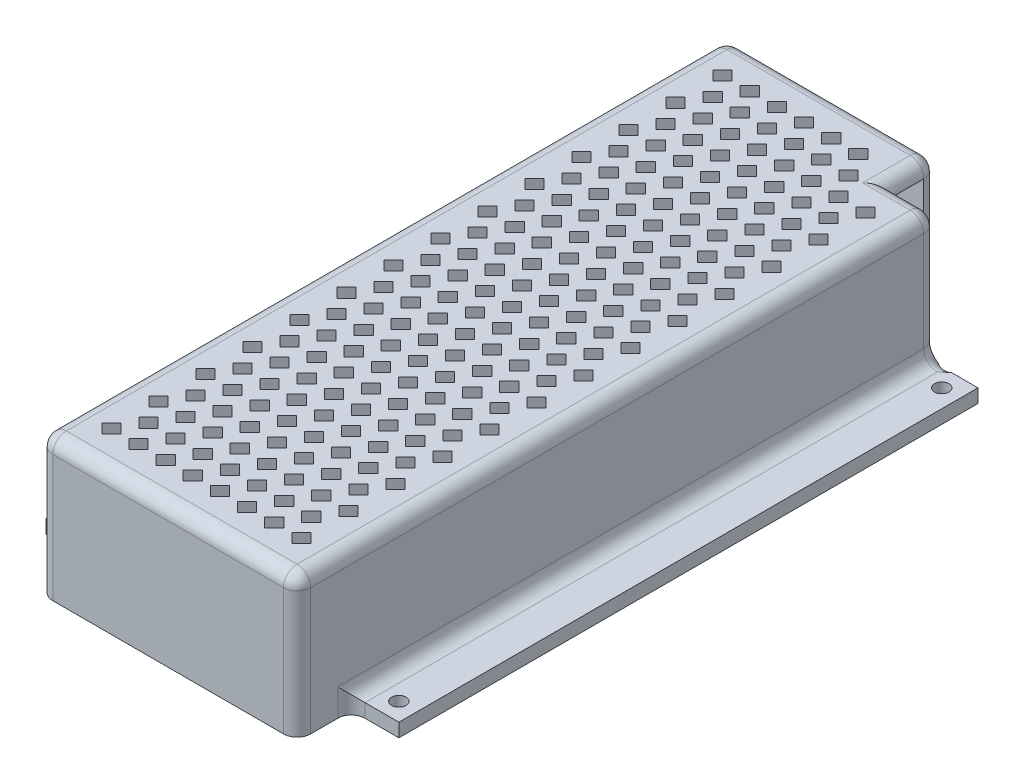
from build123d import *

# Parameters (mm, degrees)
BOSS_EXTRUDE1_DEPTH      = 73
BOSS_EXTRUDE1_DEPTH_BACK = 73
SKETCH1_W                = 51
SKETCH1_H                = 28
SHELL1_T                 = 3
SKETCH2_W                = 10.5
SKETCH2_H                = 8
SKETCH2_R                = 1.6
SKETCH2_H_2              = 112
BOSS_EXTRUDE2_DEPTH      = 3
FILLET1_R                = 3
FILLET2_R                = 3
SKETCH3_W                = 22.686699439
SKETCH3_H                = 21.76198431
CUT_EXTRUDE1_DEPTH       = 56
FILLET3_R                = 3
FILL_START               = 14
FILL_PATTERN1_DEPTH      = 3


# Read off the part's stored shape, not the designer's step: Fill Pattern1
with BuildPart() as part:
    # Sketch1 → Boss-Extrude1 (new, two sides: drawn at the far end of the back side and taken through both)
    with BuildSketch(Plane.XY.offset(-BOSS_EXTRUDE1_DEPTH_BACK)):
        Rectangle(SKETCH1_W, SKETCH1_H)
    extrude(amount=BOSS_EXTRUDE1_DEPTH + BOSS_EXTRUDE1_DEPTH_BACK)

    # Shell1
    shell1_openings = [part.faces().sort_by_distance(p)[0] for p in [
        (0, -14, 0),
    ]]
    offset(amount=SHELL1_T, openings=shell1_openings, kind=Kind.INTERSECTION)

    # Sketch2 → Boss-Extrude2 (add)
    # profile 1 of 6: a face of its own
    with BuildSketch(Plane.XZ.offset(14)):
        with Locations((-33.75, 60)):
            Rectangle(SKETCH2_W, SKETCH2_H)
        with Locations(Location((-35, 60, 0), (0, 0, 270))):
            Circle(SKETCH2_R, mode=Mode.SUBTRACT)
    # profile 2 of 6: a face of its own
    with BuildSketch(Plane.XZ.offset(14)):
        with Locations((33.75, 60)):
            Rectangle(SKETCH2_W, SKETCH2_H)
        with Locations(Location((35, 60, 0), (0, 0, 270))):
            Circle(SKETCH2_R, mode=Mode.SUBTRACT)
    # profile 3 of 6: a face of its own
    with BuildSketch(Plane.XZ.offset(14)):
        with Locations((33.75, -60)):
            Rectangle(SKETCH2_W, SKETCH2_H)
        with Locations(Location((35, -60, 0), (0, 0, 270))):
            Circle(SKETCH2_R, mode=Mode.SUBTRACT)
    # profile 4 of 6: a face of its own
    with BuildSketch(Plane.XZ.offset(14)):
        with Locations((-33.75, -60)):
            Rectangle(SKETCH2_W, SKETCH2_H)
        with Locations(Location((-35, -60, 0), (0, 0, 270))):
            Circle(SKETCH2_R, mode=Mode.SUBTRACT)
    # profile 5 of 6: a face of its own
    with BuildSketch(Plane.XZ.offset(14)):
        with Locations((-33.75, 0)):
            Rectangle(SKETCH2_W, SKETCH2_H_2)
    # profile 6 of 6: a face of its own
    with BuildSketch(Plane.XZ.offset(14)):
        with Locations((33.75, 0)):
            Rectangle(SKETCH2_W, SKETCH2_H_2)
    extrude(amount=-BOSS_EXTRUDE2_DEPTH)

    # Fillet1
    fillet1_edges = [part.edges().sort_by_distance(p)[0] for p in [
        (-28.5, -12.5, 64),
        (-28.5, -12.5, -64),
        (-28.5, -11, 0),
        (28.5, -12.5, 64),
        (28.5, -12.5, -64),
        (28.5, -11, 0),
    ]]
    fillet(fillet1_edges, radius=FILLET1_R)

    # Fillet2
    fillet2_edges = [part.edges().sort_by_distance(p)[0] for p in [
        (28.5, 1.5, 76),
        (-28.5, 1.5, -76),
        (0, 17, 76),
        (-28.5, 1.5, 76),
        (28.5, 1.5, -76),
        (-28.5, 17, 0),
        (28.5, 17, 0),
        (0, 17, -76),
    ]]
    fillet(fillet2_edges, radius=FILLET2_R)

    # Sketch3 → Cut-Extrude1 (cut)
    with BuildSketch(Plane(origin=(0, 17, 0), x_dir=(1, 0, 0), z_dir=(0, 1, 0))):
        with Locations((29.34334972, 76.380992155)):
            Rectangle(SKETCH3_W, SKETCH3_H)
    extrude(amount=-CUT_EXTRUDE1_DEPTH, mode=Mode.SUBTRACT)

    # Fillet3
    # the kernel refuses this fillet: 3 mm, written as the material it takes off along each edge
    with BuildSketch(Plane(origin=(18, 17, -73), x_dir=(0, -1, 0), z_dir=(0, 0, 1)), Plane(origin=(18, 17, -65.5), x_dir=(0, -1, 0), z_dir=(1, 0, 0))) as fillet3_piece_1:
        with BuildLine():
            CenterArc((FILLET3_R, -FILLET3_R), FILLET3_R, 90, 90)
            Line((0, -FILLET3_R), (0, 0))
            Line((0, 0), (FILLET3_R, 0))
        make_face()
    extrude(amount=7.5, mode=Mode.SUBTRACT)
    with BuildSketch(Plane(origin=(18, 14, -73), x_dir=(0, 0, -1), z_dir=(0, -1, 0))) as fillet3_piece_2:
        with BuildLine():
            CenterArc((3 - FILLET3_R, -FILLET3_R), FILLET3_R, 0, 90)
            Line((3, -FILLET3_R), (3, 0))
            Line((3, 0), (3 - FILLET3_R, 0))
        make_face()
    revolve(axis=Axis((18, 14, -73), (1, 0, 0)), revolution_arc=90, mode=Mode.SUBTRACT)
    with BuildSketch(Plane(origin=(25.5, 14, -65.5), x_dir=(0, 1, 0), z_dir=(-1, 0, 0))) as fillet3_piece_3:
        with BuildLine():
            CenterArc((3 - FILLET3_R, -FILLET3_R), FILLET3_R, 0, 90)
            Line((3, -FILLET3_R), (3, 0))
            Line((3, 0), (3 - FILLET3_R, 0))
        make_face()
    revolve(axis=Axis((25.5, 14, -65.5), (0, 0, -1)), revolution_arc=90, mode=Mode.SUBTRACT)
    with BuildSketch(Plane(origin=(18, 14, -76), x_dir=(-1, 0, 0), z_dir=(0, -1, 0))) as fillet3_piece_4:
        with BuildLine():
            CenterArc((FILLET3_R, -FILLET3_R), FILLET3_R, 90, 90)
            Line((0, -FILLET3_R), (0, 0))
            Line((0, 0), (FILLET3_R, 0))
        make_face()
    extrude(amount=35.5, mode=Mode.SUBTRACT)
    with BuildSketch(Plane(origin=(28.5, -8, -65.5), x_dir=(-1, 0, 0), z_dir=(0, 1, 0))) as fillet3_piece_5:
        with BuildLine():
            CenterArc((FILLET3_R, FILLET3_R), FILLET3_R, 180, 90)
            Line((0, FILLET3_R), (0, 0))
            Line((0, 0), (FILLET3_R, 0))
        make_face()
    extrude(amount=22, mode=Mode.SUBTRACT)
    with BuildSketch(Plane(origin=(31.5, -8, -65.5), x_dir=(-1, 0, 0), z_dir=(0, 1, 0))) as fillet3_piece_6:
        with BuildLine():
            CenterArc((3 + FILLET3_R, FILLET3_R), FILLET3_R, 180, 90)
            Line((3, FILLET3_R), (3, 0))
            Line((3, 0), (3 + FILLET3_R, 0))
        make_face()
    revolve(axis=Axis((31.5, -8, -65.5), (0, 0, 1)), revolution_arc=173.245840569, mode=Mode.SUBTRACT)
    with BuildSketch(Plane(origin=(18, 17, -73), x_dir=(0, -1, 0), z_dir=(0, 0, 1))) as fillet3_piece_7a_section:
        with BuildLine():
            CenterArc((FILLET3_R, -FILLET3_R), FILLET3_R, 90, 90)
            Line((0, -FILLET3_R), (0, 0))
            Line((0, 0), (FILLET3_R, 0))
        make_face()
    fillet3_piece_7a = extrude(amount=15, mode=Mode.PRIVATE)
    fillet3_piece_7a = split(fillet3_piece_7a, bisect_by=Plane(origin=(17.320814657, 16.320814657, -65.5), z_dir=(0, 0, 1)), keep=Keep.TOP, mode=Mode.PRIVATE)
    with BuildSketch(Plane(origin=(10.5, 17, -65.5), x_dir=(0, -1, 0), z_dir=(1, 0, 0))) as fillet3_piece_7b_section:
        with BuildLine():
            CenterArc((FILLET3_R, -FILLET3_R), FILLET3_R, 90, 90)
            Line((0, -FILLET3_R), (0, 0))
            Line((0, 0), (FILLET3_R, 0))
        make_face()
    fillet3_piece_7b = extrude(amount=15, mode=Mode.PRIVATE)
    fillet3_piece_7b = split(fillet3_piece_7b, bisect_by=Plane(origin=(18, 16.320814657, -64.820814657), z_dir=(-1, 0, 0)), keep=Keep.TOP, mode=Mode.PRIVATE)
    fillet3_piece_7 = fillet3_piece_7a & fillet3_piece_7b
    add(fillet3_piece_7, mode=Mode.SUBTRACT)

    # Fill Pattern1 outline → Fill Pattern1 (cut)
    with BuildSketch(Plane(origin=(0, 0, 0), x_dir=(1, 0, 0), z_dir=(0, 1, 0)).offset(FILL_START)):
        Polygon((-21, -69.671301839), (-18.878679656, -67.549981495), (-21, -65.428661152), (-23.121320344, -67.549981495), align=None)
        Polygon((18, 8.270984502), (20.121320344, 10.392304845), (18, 12.513625189), (15.878679656, 10.392304845), align=None)
        Polygon((12, 8.270984502), (14.121320344, 10.392304845), (12, 12.513625189), (9.878679656, 10.392304845), align=None)
        Polygon((12, -2.121320344), (14.121320344, 0), (12, 2.121320344), (9.878679656, 0), align=None)
        Polygon((12, -12.513625189), (14.121320344, -10.392304845), (12, -8.270984502), (9.878679656, -10.392304845), align=None)
        Polygon((12, -22.905930034), (14.121320344, -20.784609691), (12, -18.663289347), (9.878679656, -20.784609691), align=None)
        Polygon((12, -33.29823488), (14.121320344, -31.176914536), (12, -29.055594193), (9.878679656, -31.176914536), align=None)
        Polygon((12, -43.690539725), (14.121320344, -41.569219382), (12, -39.447899038), (9.878679656, -41.569219382), align=None)
        Polygon((12, -54.082844571), (14.121320344, -51.961524227), (12, -49.840203884), (9.878679656, -51.961524227), align=None)
        Polygon((9, -28.102082457), (11.121320344, -25.980762114), (9, -23.85944177), (6.878679656, -25.980762114), align=None)
        Polygon((9, -17.709777612), (11.121320344, -15.588457268), (9, -13.467136925), (6.878679656, -15.588457268), align=None)
        Polygon((9, -7.317472766), (11.121320344, -5.196152423), (9, -3.074832079), (6.878679656, -5.196152423), align=None)
        Polygon((9, 3.074832079), (11.121320344, 5.196152423), (9, 7.317472766), (6.878679656, 5.196152423), align=None)
        Polygon((12, -64.475149416), (14.121320344, -62.353829072), (12, -60.232508729), (9.878679656, -62.353829072), align=None)
        Polygon((21, 13.467136925), (23.121320344, 15.588457268), (21, 17.709777612), (18.878679656, 15.588457268), align=None)
        Polygon((15, 13.467136925), (17.121320344, 15.588457268), (15, 17.709777612), (12.878679656, 15.588457268), align=None)
        Polygon((9, 13.467136925), (11.121320344, 15.588457268), (9, 17.709777612), (6.878679656, 15.588457268), align=None)
        Polygon((18, -43.690539725), (20.121320344, -41.569219382), (18, -39.447899038), (15.878679656, -41.569219382), align=None)
        Polygon((18, -54.082844571), (20.121320344, -51.961524227), (18, -49.840203884), (15.878679656, -51.961524227), align=None)
        Polygon((18, -64.475149416), (20.121320344, -62.353829072), (18, -60.232508729), (15.878679656, -62.353829072), align=None)
        Polygon((21, 3.074832079), (23.121320344, 5.196152423), (21, 7.317472766), (18.878679656, 5.196152423), align=None)
        Polygon((18, -33.29823488), (20.121320344, -31.176914536), (18, -29.055594193), (15.878679656, -31.176914536), align=None)
        Polygon((18, -22.905930034), (20.121320344, -20.784609691), (18, -18.663289347), (15.878679656, -20.784609691), align=None)
        Polygon((18, -12.513625189), (20.121320344, -10.392304845), (18, -8.270984502), (15.878679656, -10.392304845), align=None)
        Polygon((18, -2.121320344), (20.121320344, 0), (18, 2.121320344), (15.878679656, 0), align=None)
        Polygon((15, 3.074832079), (17.121320344, 5.196152423), (15, 7.317472766), (12.878679656, 5.196152423), align=None)
        Polygon((15, -7.317472766), (17.121320344, -5.196152423), (15, -3.074832079), (12.878679656, -5.196152423), align=None)
        Polygon((15, -17.709777612), (17.121320344, -15.588457268), (15, -13.467136925), (12.878679656, -15.588457268), align=None)
        Polygon((15, -28.102082457), (17.121320344, -25.980762114), (15, -23.85944177), (12.878679656, -25.980762114), align=None)
        Polygon((15, -38.494387303), (17.121320344, -36.373066959), (15, -34.251746615), (12.878679656, -36.373066959), align=None)
        Polygon((15, -48.886692148), (17.121320344, -46.765371804), (15, -44.644051461), (12.878679656, -46.765371804), align=None)
        Polygon((15, -59.278996993), (17.121320344, -57.15767665), (15, -55.036356306), (12.878679656, -57.15767665), align=None)
        Polygon((15, -69.671301839), (17.121320344, -67.549981495), (15, -65.428661152), (12.878679656, -67.549981495), align=None)
        Polygon((15, 23.85944177), (17.121320344, 25.980762114), (15, 28.102082457), (12.878679656, 25.980762114), align=None)
        Polygon((9, 23.85944177), (11.121320344, 25.980762114), (9, 28.102082457), (6.878679656, 25.980762114), align=None)
        Polygon((3, 23.85944177), (5.121320344, 25.980762114), (3, 28.102082457), (0.878679656, 25.980762114), align=None)
        Polygon((3, 13.467136925), (5.121320344, 15.588457268), (3, 17.709777612), (0.878679656, 15.588457268), align=None)
        Polygon((3, 3.074832079), (5.121320344, 5.196152423), (3, 7.317472766), (0.878679656, 5.196152423), align=None)
        Polygon((3, -7.317472766), (5.121320344, -5.196152423), (3, -3.074832079), (0.878679656, -5.196152423), align=None)
        Polygon((3, -17.709777612), (5.121320344, -15.588457268), (3, -13.467136925), (0.878679656, -15.588457268), align=None)
        Polygon((3, -28.102082457), (5.121320344, -25.980762114), (3, -23.85944177), (0.878679656, -25.980762114), align=None)
        Polygon((3, -38.494387303), (5.121320344, -36.373066959), (3, -34.251746615), (0.878679656, -36.373066959), align=None)
        Polygon((3, -48.886692148), (5.121320344, -46.765371804), (3, -44.644051461), (0.878679656, -46.765371804), align=None)
        Polygon((3, -59.278996993), (5.121320344, -57.15767665), (3, -55.036356306), (0.878679656, -57.15767665), align=None)
        Polygon((3, -69.671301839), (5.121320344, -67.549981495), (3, -65.428661152), (0.878679656, -67.549981495), align=None)
        Polygon((18, 29.055594193), (20.121320344, 31.176914536), (18, 33.29823488), (15.878679656, 31.176914536), align=None)
        Polygon((12, 29.055594193), (14.121320344, 31.176914536), (12, 33.29823488), (9.878679656, 31.176914536), align=None)
        Polygon((6, 29.055594193), (8.121320344, 31.176914536), (6, 33.29823488), (3.878679656, 31.176914536), align=None)
        Polygon((0, 29.055594193), (2.121320344, 31.176914536), (0, 33.29823488), (-2.121320344, 31.176914536), align=None)
        Polygon((9, -38.494387303), (11.121320344, -36.373066959), (9, -34.251746615), (6.878679656, -36.373066959), align=None)
        Polygon((9, -48.886692148), (11.121320344, -46.765371804), (9, -44.644051461), (6.878679656, -46.765371804), align=None)
        Polygon((9, -59.278996993), (11.121320344, -57.15767665), (9, -55.036356306), (6.878679656, -57.15767665), align=None)
        Polygon((9, -69.671301839), (11.121320344, -67.549981495), (9, -65.428661152), (6.878679656, -67.549981495), align=None)
        Polygon((18, 18.663289347), (20.121320344, 20.784609691), (18, 22.905930034), (15.878679656, 20.784609691), align=None)
        Polygon((12, 18.663289347), (14.121320344, 20.784609691), (12, 22.905930034), (9.878679656, 20.784609691), align=None)
        Polygon((6, 18.663289347), (8.121320344, 20.784609691), (6, 22.905930034), (3.878679656, 20.784609691), align=None)
        Polygon((6, 8.270984502), (8.121320344, 10.392304845), (6, 12.513625189), (3.878679656, 10.392304845), align=None)
        Polygon((6, -43.690539725), (8.121320344, -41.569219382), (6, -39.447899038), (3.878679656, -41.569219382), align=None)
        Polygon((6, -54.082844571), (8.121320344, -51.961524227), (6, -49.840203884), (3.878679656, -51.961524227), align=None)
        Polygon((6, -64.475149416), (8.121320344, -62.353829072), (6, -60.232508729), (3.878679656, -62.353829072), align=None)
        Polygon((21, 23.85944177), (23.121320344, 25.980762114), (21, 28.102082457), (18.878679656, 25.980762114), align=None)
        Polygon((6, -33.29823488), (8.121320344, -31.176914536), (6, -29.055594193), (3.878679656, -31.176914536), align=None)
        Polygon((6, -22.905930034), (8.121320344, -20.784609691), (6, -18.663289347), (3.878679656, -20.784609691), align=None)
        Polygon((6, -12.513625189), (8.121320344, -10.392304845), (6, -8.270984502), (3.878679656, -10.392304845), align=None)
        Polygon((6, -2.121320344), (8.121320344, 0), (6, 2.121320344), (3.878679656, 0), align=None)
        Polygon((21, -69.671301839), (23.121320344, -67.549981495), (21, -65.428661152), (18.878679656, -67.549981495), align=None)
        Polygon((21, -59.278996993), (23.121320344, -57.15767665), (21, -55.036356306), (18.878679656, -57.15767665), align=None)
        Polygon((21, -48.886692148), (23.121320344, -46.765371804), (21, -44.644051461), (18.878679656, -46.765371804), align=None)
        Polygon((21, -38.494387303), (23.121320344, -36.373066959), (21, -34.251746615), (18.878679656, -36.373066959), align=None)
        Polygon((21, -28.102082457), (23.121320344, -25.980762114), (21, -23.85944177), (18.878679656, -25.980762114), align=None)
        Polygon((21, -17.709777612), (23.121320344, -15.588457268), (21, -13.467136925), (18.878679656, -15.588457268), align=None)
        Polygon((21, -7.317472766), (23.121320344, -5.196152423), (21, -3.074832079), (18.878679656, -5.196152423), align=None)
        Polygon((-15, 34.251746615), (-12.878679656, 36.373066959), (-15, 38.494387303), (-17.121320344, 36.373066959), align=None)
        Polygon((-15, 23.85944177), (-12.878679656, 25.980762114), (-15, 28.102082457), (-17.121320344, 25.980762114), align=None)
        Polygon((-15, 13.467136925), (-12.878679656, 15.588457268), (-15, 17.709777612), (-17.121320344, 15.588457268), align=None)
        Polygon((-15, 3.074832079), (-12.878679656, 5.196152423), (-15, 7.317472766), (-17.121320344, 5.196152423), align=None)
        Polygon((-15, -7.317472766), (-12.878679656, -5.196152423), (-15, -3.074832079), (-17.121320344, -5.196152423), align=None)
        Polygon((-15, -17.709777612), (-12.878679656, -15.588457268), (-15, -13.467136925), (-17.121320344, -15.588457268), align=None)
        Polygon((-15, -28.102082457), (-12.878679656, -25.980762114), (-15, -23.85944177), (-17.121320344, -25.980762114), align=None)
        Polygon((-15, -38.494387303), (-12.878679656, -36.373066959), (-15, -34.251746615), (-17.121320344, -36.373066959), align=None)
        Polygon((-12, 60.232508729), (-9.878679656, 62.353829072), (-12, 64.475149416), (-14.121320344, 62.353829072), align=None)
        Polygon((-6, 60.232508729), (-3.878679656, 62.353829072), (-6, 64.475149416), (-8.121320344, 62.353829072), align=None)
        Polygon((0, 60.232508729), (2.121320344, 62.353829072), (0, 64.475149416), (-2.121320344, 62.353829072), align=None)
        Polygon((6, 60.232508729), (8.121320344, 62.353829072), (6, 64.475149416), (3.878679656, 62.353829072), align=None)
        Polygon((-15, -48.886692148), (-12.878679656, -46.765371804), (-15, -44.644051461), (-17.121320344, -46.765371804), align=None)
        Polygon((-15, -59.278996993), (-12.878679656, -57.15767665), (-15, -55.036356306), (-17.121320344, -57.15767665), align=None)
        Polygon((-15, -69.671301839), (-12.878679656, -67.549981495), (-15, -65.428661152), (-17.121320344, -67.549981495), align=None)
        Polygon((12, 60.232508729), (14.121320344, 62.353829072), (12, 64.475149416), (9.878679656, 62.353829072), align=None)
        Polygon((-12, 18.663289347), (-9.878679656, 20.784609691), (-12, 22.905930034), (-14.121320344, 20.784609691), align=None)
        Polygon((-12, 8.270984502), (-9.878679656, 10.392304845), (-12, 12.513625189), (-14.121320344, 10.392304845), align=None)
        Polygon((-12, -2.121320344), (-9.878679656, 0), (-12, 2.121320344), (-14.121320344, 0), align=None)
        Polygon((-12, -12.513625189), (-9.878679656, -10.392304845), (-12, -8.270984502), (-14.121320344, -10.392304845), align=None)
        Polygon((-12, -22.905930034), (-9.878679656, -20.784609691), (-12, -18.663289347), (-14.121320344, -20.784609691), align=None)
        Polygon((-12, -33.29823488), (-9.878679656, -31.176914536), (-12, -29.055594193), (-14.121320344, -31.176914536), align=None)
        Polygon((-12, -43.690539725), (-9.878679656, -41.569219382), (-12, -39.447899038), (-14.121320344, -41.569219382), align=None)
        Polygon((-12, -54.082844571), (-9.878679656, -51.961524227), (-12, -49.840203884), (-14.121320344, -51.961524227), align=None)
        Polygon((-15, 44.644051461), (-12.878679656, 46.765371804), (-15, 48.886692148), (-17.121320344, 46.765371804), align=None)
        Polygon((-15, 55.036356306), (-12.878679656, 57.15767665), (-15, 59.278996993), (-17.121320344, 57.15767665), align=None)
        Polygon((-9, 55.036356306), (-6.878679656, 57.15767665), (-9, 59.278996993), (-11.121320344, 57.15767665), align=None)
        Polygon((-3, 55.036356306), (-0.878679656, 57.15767665), (-3, 59.278996993), (-5.121320344, 57.15767665), align=None)
        Polygon((-12, -64.475149416), (-9.878679656, -62.353829072), (-12, -60.232508729), (-14.121320344, -62.353829072), align=None)
        Polygon((15, 55.036356306), (17.121320344, 57.15767665), (15, 59.278996993), (12.878679656, 57.15767665), align=None)
        Polygon((9, 55.036356306), (11.121320344, 57.15767665), (9, 59.278996993), (6.878679656, 57.15767665), align=None)
        Polygon((3, 55.036356306), (5.121320344, 57.15767665), (3, 59.278996993), (0.878679656, 57.15767665), align=None)
        Polygon((-21, -59.278996993), (-18.878679656, -57.15767665), (-21, -55.036356306), (-23.121320344, -57.15767665), align=None)
        Polygon((-21, -48.886692148), (-18.878679656, -46.765371804), (-21, -44.644051461), (-23.121320344, -46.765371804), align=None)
        Polygon((-21, -38.494387303), (-18.878679656, -36.373066959), (-21, -34.251746615), (-23.121320344, -36.373066959), align=None)
        Polygon((-21, -28.102082457), (-18.878679656, -25.980762114), (-21, -23.85944177), (-23.121320344, -25.980762114), align=None)
        Polygon((-21, -17.709777612), (-18.878679656, -15.588457268), (-21, -13.467136925), (-23.121320344, -15.588457268), align=None)
        Polygon((-21, -7.317472766), (-18.878679656, -5.196152423), (-21, -3.074832079), (-23.121320344, -5.196152423), align=None)
        Polygon((-21, 3.074832079), (-18.878679656, 5.196152423), (-21, 7.317472766), (-23.121320344, 5.196152423), align=None)
        Polygon((-21, 13.467136925), (-18.878679656, 15.588457268), (-21, 17.709777612), (-23.121320344, 15.588457268), align=None)
        Polygon((-21, 23.85944177), (-18.878679656, 25.980762114), (-21, 28.102082457), (-23.121320344, 25.980762114), align=None)
        Polygon((-21, 34.251746615), (-18.878679656, 36.373066959), (-21, 38.494387303), (-23.121320344, 36.373066959), align=None)
        Polygon((-21, 44.644051461), (-18.878679656, 46.765371804), (-21, 48.886692148), (-23.121320344, 46.765371804), align=None)
        Polygon((-21, 55.036356306), (-18.878679656, 57.15767665), (-21, 59.278996993), (-23.121320344, 57.15767665), align=None)
        Polygon((-21, 65.428661152), (-18.878679656, 67.549981495), (-21, 69.671301839), (-23.121320344, 67.549981495), align=None)
        Polygon((-15, 65.428661152), (-12.878679656, 67.549981495), (-15, 69.671301839), (-17.121320344, 67.549981495), align=None)
        Polygon((-9, 65.428661152), (-6.878679656, 67.549981495), (-9, 69.671301839), (-11.121320344, 67.549981495), align=None)
        Polygon((-3, 65.428661152), (-0.878679656, 67.549981495), (-3, 69.671301839), (-5.121320344, 67.549981495), align=None)
        Polygon((-18, 60.232508729), (-15.878679656, 62.353829072), (-18, 64.475149416), (-20.121320344, 62.353829072), align=None)
        Polygon((-18, 49.840203884), (-15.878679656, 51.961524227), (-18, 54.082844571), (-20.121320344, 51.961524227), align=None)
        Polygon((-18, 39.447899038), (-15.878679656, 41.569219382), (-18, 43.690539725), (-20.121320344, 41.569219382), align=None)
        Polygon((-18, 29.055594193), (-15.878679656, 31.176914536), (-18, 33.29823488), (-20.121320344, 31.176914536), align=None)
        Polygon((-18, 18.663289347), (-15.878679656, 20.784609691), (-18, 22.905930034), (-20.121320344, 20.784609691), align=None)
        Polygon((-18, 8.270984502), (-15.878679656, 10.392304845), (-18, 12.513625189), (-20.121320344, 10.392304845), align=None)
        Polygon((-18, -2.121320344), (-15.878679656, 0), (-18, 2.121320344), (-20.121320344, 0), align=None)
        Polygon((-18, -12.513625189), (-15.878679656, -10.392304845), (-18, -8.270984502), (-20.121320344, -10.392304845), align=None)
        Polygon((3, 65.428661152), (5.121320344, 67.549981495), (3, 69.671301839), (0.878679656, 67.549981495), align=None)
        Polygon((9, 65.428661152), (11.121320344, 67.549981495), (9, 69.671301839), (6.878679656, 67.549981495), align=None)
        Polygon((21, 55.036356306), (23.121320344, 57.15767665), (21, 59.278996993), (18.878679656, 57.15767665), align=None)
        Polygon((-18, -64.475149416), (-15.878679656, -62.353829072), (-18, -60.232508729), (-20.121320344, -62.353829072), align=None)
        Polygon((-18, -54.082844571), (-15.878679656, -51.961524227), (-18, -49.840203884), (-20.121320344, -51.961524227), align=None)
        Polygon((-18, -43.690539725), (-15.878679656, -41.569219382), (-18, -39.447899038), (-20.121320344, -41.569219382), align=None)
        Polygon((-18, -33.29823488), (-15.878679656, -31.176914536), (-18, -29.055594193), (-20.121320344, -31.176914536), align=None)
        Polygon((-18, -22.905930034), (-15.878679656, -20.784609691), (-18, -18.663289347), (-20.121320344, -20.784609691), align=None)
        Polygon((-6, 8.270984502), (-3.878679656, 10.392304845), (-6, 12.513625189), (-8.121320344, 10.392304845), align=None)
        Polygon((-6, 18.663289347), (-3.878679656, 20.784609691), (-6, 22.905930034), (-8.121320344, 20.784609691), align=None)
        Polygon((-6, 29.055594193), (-3.878679656, 31.176914536), (-6, 33.29823488), (-8.121320344, 31.176914536), align=None)
        Polygon((-6, 39.447899038), (-3.878679656, 41.569219382), (-6, 43.690539725), (-8.121320344, 41.569219382), align=None)
        Polygon((0, 39.447899038), (2.121320344, 41.569219382), (0, 43.690539725), (-2.121320344, 41.569219382), align=None)
        Polygon((6, 39.447899038), (8.121320344, 41.569219382), (6, 43.690539725), (3.878679656, 41.569219382), align=None)
        Polygon((12, 39.447899038), (14.121320344, 41.569219382), (12, 43.690539725), (9.878679656, 41.569219382), align=None)
        Polygon((18, 39.447899038), (20.121320344, 41.569219382), (18, 43.690539725), (15.878679656, 41.569219382), align=None)
        Polygon((-3, -69.671301839), (-0.878679656, -67.549981495), (-3, -65.428661152), (-5.121320344, -67.549981495), align=None)
        Polygon((-3, -59.278996993), (-0.878679656, -57.15767665), (-3, -55.036356306), (-5.121320344, -57.15767665), align=None)
        Polygon((-3, -48.886692148), (-0.878679656, -46.765371804), (-3, -44.644051461), (-5.121320344, -46.765371804), align=None)
        Polygon((-3, -38.494387303), (-0.878679656, -36.373066959), (-3, -34.251746615), (-5.121320344, -36.373066959), align=None)
        Polygon((-3, -28.102082457), (-0.878679656, -25.980762114), (-3, -23.85944177), (-5.121320344, -25.980762114), align=None)
        Polygon((-3, -17.709777612), (-0.878679656, -15.588457268), (-3, -13.467136925), (-5.121320344, -15.588457268), align=None)
        Polygon((-3, -7.317472766), (-0.878679656, -5.196152423), (-3, -3.074832079), (-5.121320344, -5.196152423), align=None)
        Polygon((-3, 3.074832079), (-0.878679656, 5.196152423), (-3, 7.317472766), (-5.121320344, 5.196152423), align=None)
        Polygon((0, 18.663289347), (2.121320344, 20.784609691), (0, 22.905930034), (-2.121320344, 20.784609691), align=None)
        Polygon((0, 8.270984502), (2.121320344, 10.392304845), (0, 12.513625189), (-2.121320344, 10.392304845), align=None)
        Polygon((0, -2.121320344), (2.121320344, 0), (0, 2.121320344), (-2.121320344, 0), align=None)
        Polygon((0, -12.513625189), (2.121320344, -10.392304845), (0, -8.270984502), (-2.121320344, -10.392304845), align=None)
        Polygon((0, -22.905930034), (2.121320344, -20.784609691), (0, -18.663289347), (-2.121320344, -20.784609691), align=None)
        Polygon((0, -33.29823488), (2.121320344, -31.176914536), (0, -29.055594193), (-2.121320344, -31.176914536), align=None)
        Polygon((0, -43.690539725), (2.121320344, -41.569219382), (0, -39.447899038), (-2.121320344, -41.569219382), align=None)
        Polygon((0, -54.082844571), (2.121320344, -51.961524227), (0, -49.840203884), (-2.121320344, -51.961524227), align=None)
        Polygon((-3, 13.467136925), (-0.878679656, 15.588457268), (-3, 17.709777612), (-5.121320344, 15.588457268), align=None)
        Polygon((-3, 23.85944177), (-0.878679656, 25.980762114), (-3, 28.102082457), (-5.121320344, 25.980762114), align=None)
        Polygon((-3, 34.251746615), (-0.878679656, 36.373066959), (-3, 38.494387303), (-5.121320344, 36.373066959), align=None)
        Polygon((3, 34.251746615), (5.121320344, 36.373066959), (3, 38.494387303), (0.878679656, 36.373066959), align=None)
        Polygon((0, -64.475149416), (2.121320344, -62.353829072), (0, -60.232508729), (-2.121320344, -62.353829072), align=None)
        Polygon((21, 34.251746615), (23.121320344, 36.373066959), (21, 38.494387303), (18.878679656, 36.373066959), align=None)
        Polygon((15, 34.251746615), (17.121320344, 36.373066959), (15, 38.494387303), (12.878679656, 36.373066959), align=None)
        Polygon((9, 34.251746615), (11.121320344, 36.373066959), (9, 38.494387303), (6.878679656, 36.373066959), align=None)
        Polygon((-12, 29.055594193), (-9.878679656, 31.176914536), (-12, 33.29823488), (-14.121320344, 31.176914536), align=None)
        Polygon((-12, 39.447899038), (-9.878679656, 41.569219382), (-12, 43.690539725), (-14.121320344, 41.569219382), align=None)
        Polygon((-12, 49.840203884), (-9.878679656, 51.961524227), (-12, 54.082844571), (-14.121320344, 51.961524227), align=None)
        Polygon((-6, 49.840203884), (-3.878679656, 51.961524227), (-6, 54.082844571), (-8.121320344, 51.961524227), align=None)
        Polygon((0, 49.840203884), (2.121320344, 51.961524227), (0, 54.082844571), (-2.121320344, 51.961524227), align=None)
        Polygon((6, 49.840203884), (8.121320344, 51.961524227), (6, 54.082844571), (3.878679656, 51.961524227), align=None)
        Polygon((12, 49.840203884), (14.121320344, 51.961524227), (12, 54.082844571), (9.878679656, 51.961524227), align=None)
        Polygon((18, 49.840203884), (20.121320344, 51.961524227), (18, 54.082844571), (15.878679656, 51.961524227), align=None)
        Polygon((-9, -69.671301839), (-6.878679656, -67.549981495), (-9, -65.428661152), (-11.121320344, -67.549981495), align=None)
        Polygon((-9, -59.278996993), (-6.878679656, -57.15767665), (-9, -55.036356306), (-11.121320344, -57.15767665), align=None)
        Polygon((-9, -48.886692148), (-6.878679656, -46.765371804), (-9, -44.644051461), (-11.121320344, -46.765371804), align=None)
        Polygon((-9, -38.494387303), (-6.878679656, -36.373066959), (-9, -34.251746615), (-11.121320344, -36.373066959), align=None)
        Polygon((-9, -28.102082457), (-6.878679656, -25.980762114), (-9, -23.85944177), (-11.121320344, -25.980762114), align=None)
        Polygon((-9, -17.709777612), (-6.878679656, -15.588457268), (-9, -13.467136925), (-11.121320344, -15.588457268), align=None)
        Polygon((-9, -7.317472766), (-6.878679656, -5.196152423), (-9, -3.074832079), (-11.121320344, -5.196152423), align=None)
        Polygon((-9, 3.074832079), (-6.878679656, 5.196152423), (-9, 7.317472766), (-11.121320344, 5.196152423), align=None)
        Polygon((-6, -43.690539725), (-3.878679656, -41.569219382), (-6, -39.447899038), (-8.121320344, -41.569219382), align=None)
        Polygon((-6, -54.082844571), (-3.878679656, -51.961524227), (-6, -49.840203884), (-8.121320344, -51.961524227), align=None)
        Polygon((-6, -64.475149416), (-3.878679656, -62.353829072), (-6, -60.232508729), (-8.121320344, -62.353829072), align=None)
        Polygon((21, 44.644051461), (23.121320344, 46.765371804), (21, 48.886692148), (18.878679656, 46.765371804), align=None)
        Polygon((-6, -33.29823488), (-3.878679656, -31.176914536), (-6, -29.055594193), (-8.121320344, -31.176914536), align=None)
        Polygon((-6, -22.905930034), (-3.878679656, -20.784609691), (-6, -18.663289347), (-8.121320344, -20.784609691), align=None)
        Polygon((-6, -12.513625189), (-3.878679656, -10.392304845), (-6, -8.270984502), (-8.121320344, -10.392304845), align=None)
        Polygon((-6, -2.121320344), (-3.878679656, 0), (-6, 2.121320344), (-8.121320344, 0), align=None)
        Polygon((15, 44.644051461), (17.121320344, 46.765371804), (15, 48.886692148), (12.878679656, 46.765371804), align=None)
        Polygon((9, 44.644051461), (11.121320344, 46.765371804), (9, 48.886692148), (6.878679656, 46.765371804), align=None)
        Polygon((3, 44.644051461), (5.121320344, 46.765371804), (3, 48.886692148), (0.878679656, 46.765371804), align=None)
        Polygon((-3, 44.644051461), (-0.878679656, 46.765371804), (-3, 48.886692148), (-5.121320344, 46.765371804), align=None)
        Polygon((-9, 44.644051461), (-6.878679656, 46.765371804), (-9, 48.886692148), (-11.121320344, 46.765371804), align=None)
        Polygon((-9, 34.251746615), (-6.878679656, 36.373066959), (-9, 38.494387303), (-11.121320344, 36.373066959), align=None)
        Polygon((-9, 23.85944177), (-6.878679656, 25.980762114), (-9, 28.102082457), (-11.121320344, 25.980762114), align=None)
        Polygon((-9, 13.467136925), (-6.878679656, 15.588457268), (-9, 17.709777612), (-11.121320344, 15.588457268), align=None)
    extrude(amount=FILL_PATTERN1_DEPTH, mode=Mode.SUBTRACT)


solid = part.part
